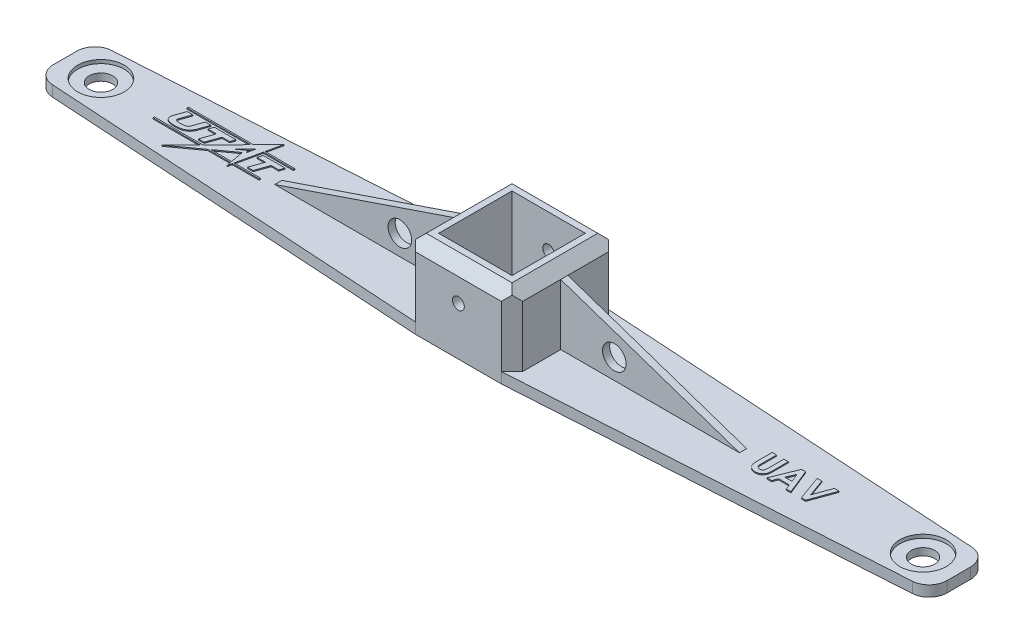
from build123d import *

# Parameters (mm, degrees)
SKETCH1_W           = 250
SKETCH1_H           = 30
BOSS_EXTRUDE1_DEPTH = 3
SKETCH2_W           = 20.5
SKETCH2_H           = 20.5
CUT_EXTRUDE1_DEPTH  = 3
SKETCH3_W           = 30
SKETCH3_H           = 30
SKETCH3_W_2         = 20.5
SKETCH3_H_2         = 20.5
BOSS_EXTRUDE2_DEPTH = 20
CHAMFER1_SIZE       = 3
SKETCH4_R           = 1.65
CUT_EXTRUDE2_DEPTH  = 40
CHAMFER2_SIZE       = 3
CUT_EXTRUDE3_DEPTH  = 40
SKETCH6_W           = 50
SKETCH6_H           = 2
BOSS_EXTRUDE3_DEPTH = 17
CUT_EXTRUDE4_DEPTH  = 17
SKETCH8_R           = 3.302
CUT_EXTRUDE5_DEPTH  = 17
SKETCH9_R           = 3.302
CUT_EXTRUDE6_DEPTH  = 17
SKETCH10_R          = 6.5
CUT_EXTRUDE7_DEPTH  = 1
SKETCH11_R          = 6.5
CUT_EXTRUDE8_DEPTH  = 1
FILLET1_R           = 5
BOSS_EXTRUDE4_DEPTH = 0.3
BOSS_EXTRUDE5_DEPTH = 0.3


# Read off the part's stored shape, not the designer's step: Boss-Extrude4
with BuildPart() as part:
    # Sketch1 → Boss-Extrude1 (new body)
    with BuildSketch(Plane(origin=(0, 0, 0), x_dir=(1, 0, 0), z_dir=(0, 1, 0))):
        Rectangle(SKETCH1_W, SKETCH1_H)
    extrude(amount=BOSS_EXTRUDE1_DEPTH)

    # Sketch2 → Cut-Extrude1 (cut)
    with BuildSketch(Plane(origin=(0, 3, 0), x_dir=(1, 0, 0), z_dir=(0, 1, 0))):
        Rectangle(SKETCH2_W, SKETCH2_H)
    extrude(amount=-CUT_EXTRUDE1_DEPTH, mode=Mode.SUBTRACT)

    # Sketch3 → Boss-Extrude2 (add)
    with BuildSketch(Plane(origin=(0, 3, 0), x_dir=(1, 0, 0), z_dir=(0, 1, 0))):
        Rectangle(SKETCH3_W, SKETCH3_H)
        Rectangle(SKETCH3_W_2, SKETCH3_H_2, mode=Mode.SUBTRACT)
    extrude(amount=BOSS_EXTRUDE2_DEPTH)

    # Chamfer1
    chamfer1_edges = [part.edges().sort_by_distance(p)[0] for p in [
        (15, 13, 15),
        (15, 13, -15),
        (-15, 13, -15),
        (-15, 13, 15),
    ]]
    chamfer(chamfer1_edges, length=CHAMFER1_SIZE)

    # Sketch4 → Cut-Extrude2 (cut)
    with BuildSketch(Plane.XY.offset(15)):
        with Locations((0, 13.514664597)):
            Circle(SKETCH4_R)
    extrude(amount=-CUT_EXTRUDE2_DEPTH, mode=Mode.SUBTRACT)

    # Chamfer2
    # the kernel refuses this chamfer: 3 mm, written as the material it takes off along each edge
    with BuildSketch(Plane(origin=(19.715048964, 23, -15), x_dir=(0, -0.9996219169112968, -0.02749587661058619), z_dir=(-1, 0, 0))) as chamfer2_piece_1:
        Polygon((CHAMFER2_SIZE * 0.999621916911, CHAMFER2_SIZE * 0.0274958766106), (-CHAMFER2_SIZE * 0.0274958766106, CHAMFER2_SIZE * 0.999621916911), (0, 0), align=None)
    extrude(amount=39.430097928, mode=Mode.SUBTRACT)
    with BuildSketch(Plane(origin=(15, 23, 19.715048964), x_dir=(-0.9996219169112968, 0.02749587661058678, 0), z_dir=(0, 0, -1)), Plane(origin=(-19.715048964, 23, 15), x_dir=(0, 0.02749587661058678, -0.9996219169112968), z_dir=(1, 0, 0)), Plane(origin=(-15, 23, -19.715048964), x_dir=(0.9996219169112968, 0.02749587661058678, 0), z_dir=(0, 0, 1))) as chamfer2_piece_2:
        Polygon((CHAMFER2_SIZE * 0.999621916911, -CHAMFER2_SIZE * 0.0274958766106), (-CHAMFER2_SIZE * 0.0274958766106, -CHAMFER2_SIZE * 0.999621916911), (0, 0), align=None)
    extrude(amount=39.430097928, mode=Mode.SUBTRACT)

    # Sketch5 → Cut-Extrude3 (cut)
    with BuildSketch(Plane(origin=(0, 3, 0), x_dir=(1, 0, 0), z_dir=(0, 1, 0))):
        Polygon((-12, 15), (-125, 8), (-125, 15), align=None)
        Polygon((-12, -15), (-125, -15), (-125, -8), align=None)
        Polygon((12, 15), (125, 15), (125, 8), align=None)
        Polygon((12, -15), (125, -15), (125, -8), align=None)
    extrude(amount=-CUT_EXTRUDE3_DEPTH, mode=Mode.SUBTRACT)

    # Sketch6 → Boss-Extrude3 (add)
    with BuildSketch(Plane(origin=(0, 3, 0), x_dir=(1, 0, 0), z_dir=(0, 1, 0))):
        with Locations((-40, -0.368394866)):
            Rectangle(SKETCH6_W, SKETCH6_H)
        with Locations((40, -0.368394866)):
            Rectangle(SKETCH6_W, SKETCH6_H)
    extrude(amount=BOSS_EXTRUDE3_DEPTH)

    # Sketch7 → Cut-Extrude4 (cut)
    with BuildSketch(Plane.XY.offset(1.368394866)):
        Polygon((-15, 20), (-65, 3), (-71.38859119, 29.520775186), align=None)
        Polygon((15, 20), (65, 3), (84.413316585, 43.135600108), align=None)
    extrude(amount=-CUT_EXTRUDE4_DEPTH, mode=Mode.SUBTRACT)

    # Sketch8 → Cut-Extrude5 (cut)
    with BuildSketch(Plane.XY.offset(1.368394866)):
        with Locations((-30, 8.659349902)):
            Circle(SKETCH8_R)
        with Locations((30, 8.659349902)):
            Circle(SKETCH8_R)
    extrude(amount=-CUT_EXTRUDE5_DEPTH, mode=Mode.SUBTRACT)

    # Sketch9 → Cut-Extrude6 (cut)
    with BuildSketch(Plane(origin=(0, 3, 0), x_dir=(1, 0, 0), z_dir=(0, 1, 0))):
        with Locations(Location((-115, 0, 0), (0, 0, 270))):
            Circle(SKETCH9_R)
        with Locations(Location((115, 0, 0), (0, 0, 270))):
            Circle(SKETCH9_R)
    extrude(amount=-CUT_EXTRUDE6_DEPTH, mode=Mode.SUBTRACT)

    # Sketch10 → Cut-Extrude7 (cut)
    with BuildSketch(Plane(origin=(0, 3, 0), x_dir=(1, 0, 0), z_dir=(0, 1, 0))):
        with Locations(Location((115, 0, 0), (0, 0, 270))):
            Circle(SKETCH10_R)
    extrude(amount=-CUT_EXTRUDE7_DEPTH, mode=Mode.SUBTRACT)

    # Sketch11 → Cut-Extrude8 (cut)
    with BuildSketch(Plane(origin=(0, 3, 0), x_dir=(1, 0, 0), z_dir=(0, 1, 0))):
        with Locations(Location((-115, 0, 0), (0, 0, 270))):
            Circle(SKETCH11_R)
    extrude(amount=-CUT_EXTRUDE8_DEPTH, mode=Mode.SUBTRACT)

    # Fillet1
    fillet1_edges = [part.edges().sort_by_distance(p)[0] for p in [
        (-125, 1.5, -8),
        (-125, 1.5, 8),
        (125, 1.5, -8),
        (125, 1.5, 8),
    ]]
    fillet(fillet1_edges, radius=FILLET1_R)

    # Boss-Extrude4 outline → Boss-Extrude4 (add)
    # profile 1 of 4: a face of its own
    with BuildSketch(Plane(origin=(0, 3, 0), x_dir=(1, 0, 0), z_dir=(0, 1, 0))):
        with BuildLine():
            Line((-94.628176448, 3.755278229), (-95.703277672, 0.692815714))
            add(Edge.make_bspline(
                [(-95.703277672, 0.692815714), (-95.735128937, 0.579149454), (-95.763573041, 0.454188795), (-95.79570052, 0.205809026), (-95.799800611, 0.081344649), (-95.773930574, -0.162212516), (-95.743987709, -0.281535741), (-95.641715374, -0.509522313), (-95.569290051, -0.618098713), (-95.37669666, -0.817478628), (-95.256466093, -0.908181903), (-94.968752253, -1.066678276), (-94.801292115, -1.13446948), (-94.238594237, -1.301463614), (-93.782189303, -1.364702407), (-92.810198717, -1.402456879), (-92.295913214, -1.377893824), (-91.566967391, -1.258978212), (-91.331066784, -1.205296723), (-90.886540009, -1.066897231), (-90.678032701, -0.982060006), (-90.298447078, -0.782837961), (-90.127536238, -0.668470573), (-89.825708501, -0.418437974), (-89.69480112, -0.28304842), (-89.464266073, -0.0019663), (-89.364019375, 0.143302589), (-89.227353291, 0.36718353), (-89.184094541, 0.442934133), (-89.103046109, 0.597963379), (-89.065155877, 0.677289312), (-89.03256889, 0.759170995)],
                knots=[0, 0, 0, 0, 0.0625, 0.0625, 0.125, 0.125, 0.1875, 0.1875, 0.25, 0.25, 0.3125, 0.3125, 0.375, 0.375, 0.5, 0.5, 0.625, 0.625, 0.6875, 0.6875, 0.75, 0.75, 0.8125, 0.8125, 0.875, 0.875, 0.9375, 0.9375, 0.96875, 0.96875, 1, 1, 1, 1], degree=3))
            Line((-89.03256889, 0.759170995), (-87.980762479, 3.755278229))
            Line((-87.980762479, 3.755278229), (-89.555895885, 3.755278271))
            Line((-89.555895885, 3.755278271), (-90.564023473, 0.883590949))
            add(Edge.make_bspline(
                [(-90.564023473, 0.883590949), (-90.585595894, 0.838189869), (-90.613013312, 0.781929843), (-90.674820943, 0.655422238), (-90.710106374, 0.585792973), (-90.799250727, 0.448281417), (-90.853417783, 0.380568843), (-90.987949761, 0.257314744), (-91.068334746, 0.201749288), (-91.255070093, 0.106585046), (-91.361330456, 0.066905447), (-91.593383928, 0.002704127), (-91.719072598, -0.021892409), (-92.111336987, -0.077268839), (-92.392099899, -0.090246591), (-92.922619815, -0.088704342), (-93.172329557, -0.07454188), (-93.60015932, -0.018584994), (-93.779069992, 0.023629151), (-93.974607591, 0.124857045), (-94.027627232, 0.165089859), (-94.106653187, 0.260481349), (-94.132519364, 0.315802757), (-94.157513182, 0.438764731), (-94.156339997, 0.506640901), (-94.136932381, 0.641357481), (-94.118154314, 0.708447242), (-94.106548634, 0.759171038)],
                knots=[0, 0, 0, 0, 0.0625, 0.0625, 0.125, 0.125, 0.1875, 0.1875, 0.25, 0.25, 0.3125, 0.3125, 0.375, 0.375, 0.5, 0.5, 0.625, 0.625, 0.75, 0.75, 0.8125, 0.8125, 0.875, 0.875, 0.9375, 0.9375, 1, 1, 1, 1], degree=3))
            Line((-94.106548634, 0.759171038), (-93.054741231, 3.755278229))
            Line((-93.054741231, 3.755278229), (-94.628176448, 3.755278229))
        make_face()
    # profile 2 of 4: a face of its own
    with BuildSketch(Plane(origin=(0, 3, 0), x_dir=(1, 0, 0), z_dir=(0, 1, 0))):
        Polygon((-67.237064597, 3.755278229), (-73.30295777, 3.755278229), (-73.768720386, 2.428536951), (-71.398255584, 2.428536951), (-72.70893192, -1.286057294), (-71.122649667, -1.286057294), (-69.80901098, 2.436935245), (-67.702237126, 2.436935245), align=None)
    # profile 3 of 4: a face of its own
    with BuildSketch(Plane(origin=(0, 3, 0), x_dir=(1, 0, 0), z_dir=(0, 1, 0))):
        Polygon((-80.958789942, 3.755278229), (-87.022169289, 3.755278229), (-87.490302679, 2.428536951), (-85.112740454, 2.428536951), (-86.423384008, -1.305662752), (-84.844035265, -1.305662752), (-83.533391711, 2.428536951), (-81.424454209, 2.428536951), align=None)
    # profile 4 of 4: a face of its own
    with BuildSketch(Plane(origin=(0, 3, 0), x_dir=(1, 0, 0), z_dir=(0, 1, 0))):
        Polygon((-73.104444501, 9.269193648), (-77.333146689, 4.981128215), (-95.401668903, 4.981128215), (-95.545079169, 4.602303444), (-77.700406668, 4.602303444), (-84.345522878, -2.13609776), (-97.821245697, -2.13609776), (-97.959459183, -2.523878873), (-84.727935848, -2.523878873), (-90.049347636, -7.919993349), (-82.604268548, -2.523878873), (-76.21454334, -2.523878873), (-75.970450399, -3.706224919), (-75.708181021, -2.51883185), (-68.302312848, -2.51883185), (-68.160319683, -2.13609776), (-75.623640773, -2.13609776), (-74.135265109, 4.602303444), (-65.811506269, 4.602303444), (-65.67125952, 4.980323552), (-74.051767943, 4.980323552), align=None)
        Polygon((-76.295096037, -2.135426463), (-82.068316993, -2.135426463), (-77.003708837, 1.535348683), align=None, mode=Mode.SUBTRACT)
        Polygon((-78.898407874, 1.259975969), (-75.921243784, 4.294169783), (-76.420349238, 1.916440665), (-76.605126617, 2.895002901), align=None, mode=Mode.SUBTRACT)
    extrude(amount=BOSS_EXTRUDE4_DEPTH)

    # Sketch13 → Boss-Extrude5 (add)
    # profile 1 of 3: a face of its own
    with BuildSketch(Plane(origin=(0, 3, 0), x_dir=(1, 0, 0), z_dir=(0, 1, 0))):
        with BuildLine():
            Line((69.794176226, 2.995965838), (71.028898449, 2.995965838))
            Line((71.028898449, 2.995965838), (71.028898449, -1.479902217))
            add(Edge.make_bspline(
                [(71.028898449, -1.479902217), (71.028965587, -1.526306076), (71.029095263, -1.61593465), (71.035586939, -1.744522308), (71.04152727, -1.862721289), (71.052245314, -1.970402191), (71.068079538, -2.067611076), (71.083412233, -2.154972378), (71.104163521, -2.230921993), (71.135349388, -2.317372538), (71.183396571, -2.414504448), (71.261903004, -2.515737553), (71.35249271, -2.608127455), (71.461069692, -2.685029309), (71.583100616, -2.747235977), (71.717914979, -2.793324234), (71.865322739, -2.818943185), (71.967247119, -2.822854387), (72.01970791, -2.824867495)],
                knots=[0, 0, 0, 0, 1.155499968, 2.231836252, 3.205919964, 4.102923608, 4.924856345, 5.658536265, 6.31071849, 6.882491295, 7.94666036, 8.992281882, 10.060072772, 11.158554251, 12.289267114, 13.461410017, 14.693379945, 16, 16, 16, 16], degree=3))
            add(Edge.make_bspline(
                [(72.01970791, -2.824867495), (72.075441027, -2.823241162), (72.184111169, -2.820070089), (72.340415868, -2.788942571), (72.485233058, -2.739376903), (72.615496465, -2.668634062), (72.731076457, -2.583836369), (72.828912498, -2.487140426), (72.906124342, -2.378353373), (72.956448149, -2.277989032), (72.984702489, -2.185612397), (73.005880524, -2.103077378), (73.021406366, -2.005694226), (73.035491921, -1.894983788), (73.043956254, -1.769799318), (73.053134444, -1.631147564), (73.056498335, -1.478079836), (73.057071686, -1.371495904), (73.057370671, -1.315915672)],
                knots=[0, 0, 0, 0, 1.261321664, 2.459363699, 3.594844139, 4.716940403, 5.803436589, 6.833651888, 7.818396249, 8.814403945, 9.360733334, 10.004355033, 10.743453831, 11.592799886, 12.532235708, 13.585170094, 14.740740724, 16, 16, 16, 16], degree=3))
            Line((73.057370671, -1.315915672), (73.057370671, 2.995965838))
            Line((73.057370671, 2.995965838), (74.292092893, 2.995965838))
            Line((74.292092893, 2.995965838), (74.292092893, -1.107831905))
            add(Edge.make_bspline(
                [(74.292092893, -1.107831905), (74.291921429, -1.190974651), (74.291591722, -1.350850043), (74.286528403, -1.580602232), (74.275749515, -1.790444004), (74.266696492, -1.980436672), (74.249175792, -2.150324285), (74.230923333, -2.300832313), (74.207659004, -2.431427388), (74.17304308, -2.58009401), (74.113306245, -2.751278181), (74.017002634, -2.948389333), (73.894751433, -3.141373091), (73.750256623, -3.328106499), (73.587108766, -3.501575818), (73.408925198, -3.653859426), (73.218536813, -3.782674938), (73.01395419, -3.884872657), (72.795351438, -3.964579175), (72.560565647, -4.018137939), (72.309756921, -4.054322913), (72.136518593, -4.057798925), (72.047268674, -4.059589717)],
                knots=[0, 0, 0, 0, 1.170808336, 2.251350247, 3.235597562, 4.129743112, 4.929140599, 5.639994148, 6.264258765, 6.79612947, 7.788252245, 8.809469599, 9.879094798, 10.999557536, 12.129761673, 13.226370002, 14.293821979, 15.358369427, 16.438775801, 17.562147481, 18.744053101, 20, 20, 20, 20], degree=3))
            add(Edge.make_bspline(
                [(72.047268674, -4.059589717), (71.987969253, -4.058590897), (71.87097271, -4.056620245), (71.698908769, -4.039244239), (71.53257517, -4.013638541), (71.372284453, -3.976282465), (71.217480279, -3.928025391), (71.068203775, -3.868624294), (70.925009689, -3.798410505), (70.788699316, -3.71802984), (70.659440396, -3.631111987), (70.541304415, -3.534759889), (70.430226037, -3.436099147), (70.32941427, -3.330977697), (70.238111928, -3.220499136), (70.156507048, -3.104413084), (70.084720868, -2.98272985), (70.020947645, -2.853256104), (69.966363991, -2.70941116), (69.92034792, -2.546078395), (69.880147198, -2.360697732), (69.850272393, -2.152851517), (69.823187719, -1.923224788), (69.806044614, -1.671219333), (69.797076284, -1.396827922), (69.795167339, -1.206598045), (69.794176226, -1.107831905)],
                knots=[0, 0, 0, 0, 1.001158378, 1.975264943, 2.917723546, 3.841610987, 4.75185031, 5.653588123, 6.552117133, 7.442167995, 8.324307438, 9.179605724, 10.014504199, 10.831958861, 11.636465792, 12.43274043, 13.225645099, 14.020104002, 14.867201867, 15.819789774, 16.883317127, 18.068162734, 19.364263498, 20.787406516, 22.332041935, 24, 24, 24, 24], degree=3))
            Line((69.794176226, -1.107831905), (69.794176226, 2.995965838))
        make_face()
    # profile 2 of 3: a face of its own
    with BuildSketch(Plane(origin=(0, 3, 0), x_dir=(1, 0, 0), z_dir=(0, 1, 0))):
        Polygon((77.997637598, 2.995965838), (79.142787338, 2.995965838), (81.920912338, -3.883200828), (80.602129785, -3.883200828), (80.067450966, -2.472089717), (77.070217893, -2.472089717), (76.535539074, -3.883200828), (75.21813456, -3.883200828), align=None)
        Polygon((78.569523449, 1.150772696), (77.538750879, -1.237367495), (79.600296018, -1.237367495), align=None, mode=Mode.SUBTRACT)
    # profile 3 of 3: a face of its own
    with BuildSketch(Plane(origin=(0, 3, 0), x_dir=(1, 0, 0), z_dir=(0, 1, 0))):
        Polygon((82.36188456, 2.995965838), (83.680667112, 2.995965838), (85.448690115, -1.890557599), (87.220847233, 2.995965838), (88.535495671, 2.995965838), (86.041246539, -3.883200828), (84.851999577, -3.883200828), align=None)
    extrude(amount=BOSS_EXTRUDE5_DEPTH)


solid = part.part
